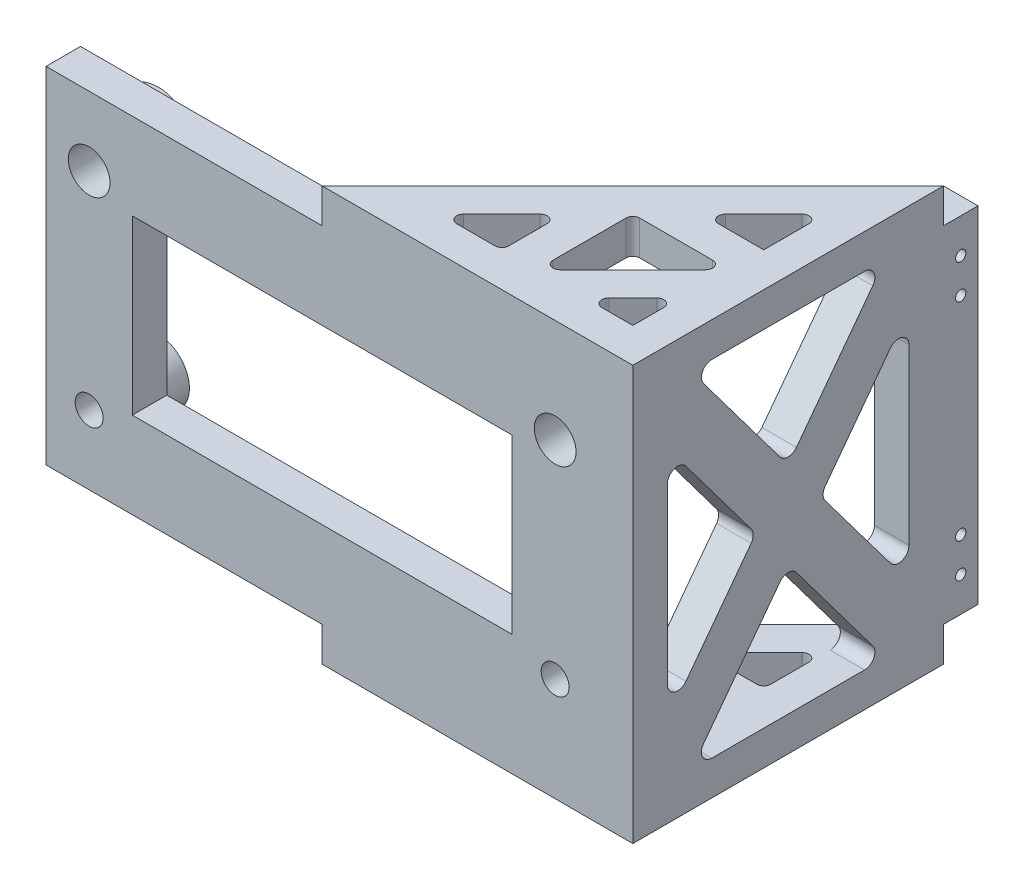
from build123d import *

# Parameters (mm, degrees)
SKETCH1_W            = 160
SKETCH1_H            = 100
SKETCH1_R            = 6.05
SKETCH1_R_2          = 4.05
SKETCH1_W_2          = 110
SKETCH1_H_2          = 50
BOSS_EXTRUDE1_DEPTH  = 10
SKETCH4_W            = 10
SKETCH4_H            = 100
BOSS_EXTRUDE3_DEPTH  = 100
BOSS_EXTRUDE4_DEPTH  = 5
BOSS_EXTRUDE5_DEPTH  = 10
CUT_EXTRUDE1_DEPTH   = 10
FILLET1_R            = 3
FILLET2_R            = 2
SKETCH13_R           = 1.5
CUT_EXTRUDE2_DEPTH   = 10
BOSS_EXTRUDE10_START = 10
SKETCH14_R           = 11.05
SKETCH14_R_2         = 6.05
SKETCH14_R_3         = 9.05
SKETCH14_R_4         = 4.05
BOSS_EXTRUDE10_DEPTH = 10


with BuildPart() as part:
    # Sketch1 → Boss-Extrude1 (new body)
    with BuildSketch(Plane.XY):
        with Locations((0, -30)):
            Rectangle(SKETCH1_W, SKETCH1_H)
        with Locations((-67.5, 0)):
            Circle(SKETCH1_R, mode=Mode.SUBTRACT)
        with Locations((67.5, 0)):
            Circle(SKETCH1_R, mode=Mode.SUBTRACT)
        with Locations((67.5, -60)):
            Circle(SKETCH1_R_2, mode=Mode.SUBTRACT)
        with Locations((-67.5, -60)):
            Circle(SKETCH1_R_2, mode=Mode.SUBTRACT)
        with Locations((0, -30)):
            Rectangle(SKETCH1_W_2, SKETCH1_H_2, mode=Mode.SUBTRACT)
    extrude(amount=BOSS_EXTRUDE1_DEPTH)

    # Sketch4 → Boss-Extrude3 (add)
    with BuildSketch(Plane.XY.offset(10)):
        with Locations((85, -30)):
            Rectangle(SKETCH4_W, SKETCH4_H)
    extrude(amount=-BOSS_EXTRUDE3_DEPTH)

    # Sketch6 → Boss-Extrude4 (add, symmetric)
    with BuildSketch(Plane(origin=(0, 25, 0), x_dir=(1, 0, 0), z_dir=(0, 1, 0))):
        Polygon((90, -10), (90, 80), (0, -10), align=None)
        Polygon((42.071067812, 0), (24.142135624, 0), (42.071067812, 17.928932188), align=None, mode=Mode.SUBTRACT)
        Polygon((80, 0), (66.213203436, 0), (80, 13.786796564), align=None, mode=Mode.SUBTRACT)
        Polygon((52.071067812, 27.928932188), (80, 27.928932188), (52.071067812, 0), align=None, mode=Mode.SUBTRACT)
        Polygon((62.071067812, 37.928932188), (80, 55.857864376), (80, 37.928932188), align=None, mode=Mode.SUBTRACT)
    extrude(amount=BOSS_EXTRUDE4_DEPTH, both=True)

    # Sketch9 → Boss-Extrude5 (add)
    with BuildSketch(Plane(origin=(0, -90, 0), x_dir=(1, 0, 0), z_dir=(0, 1, 0))):
        Polygon((90, -10), (90, 80), (0, -10), align=None)
        Polygon((24.142135624, 0), (42.071067812, 17.928932188), (42.071067812, 0), align=None, mode=Mode.SUBTRACT)
        Polygon((80, 0), (66.213203436, 0), (80, 13.786796564), align=None, mode=Mode.SUBTRACT)
        Polygon((80, 27.928932188), (52.071067812, 0), (52.071067812, 27.928932188), align=None, mode=Mode.SUBTRACT)
        Polygon((80, 37.928932188), (62.071067812, 37.928932188), (80, 55.857864376), align=None, mode=Mode.SUBTRACT)
    extrude(amount=BOSS_EXTRUDE5_DEPTH)

    # Sketch12 → Cut-Extrude1 (cut)
    with BuildSketch(Plane(origin=(90, 0, 0), x_dir=(0, 0, -1), z_dir=(1, 0, 0))):
        Polygon((25.625, -30), (0, -64.166666667), (0, 4.166666667), align=None)
        Polygon((35, -17.5), (6.875, 20), (63.125, 20), align=None)
        Polygon((35, -42.5), (6.875, -80), (63.125, -80), align=None)
        Polygon((70, -64.166666667), (70, 4.166666667), (44.375, -30), align=None)
    extrude(amount=-CUT_EXTRUDE1_DEPTH, mode=Mode.SUBTRACT)

    # Fillet1
    fillet1_edges = [part.edges().sort_by_distance(p)[0] for p in [
        (85, -42.5, -35),
        (85, -80, -63.125),
        (85, -80, -6.875),
        (85, 20, -63.125),
        (85, -17.5, -35),
        (85, 20, -6.875),
        (85, -64.166666667, -70),
        (85, -30, -44.375),
        (85, 4.166666667, -70),
        (85, 4.166666667, 0),
        (85, -30, -25.625),
        (85, -64.166666667, 0),
    ]]
    fillet(fillet1_edges, radius=FILLET1_R)

    # Fillet2
    # the kernel refuses this fillet: 2 mm, written as the material it adds along each edge
    with BuildSketch(Plane(origin=(62.071067812, -90, -37.928932188), x_dir=(0.7071067811865511, 0, -0.7071067811865438), z_dir=(0, 1, 0)), Plane(origin=(80, -90, -55.857864376), x_dir=(0, 0, 1), z_dir=(0, 1, 0)), Plane(origin=(52.071067812, -90, 0), x_dir=(0, 0, -1), z_dir=(0, 1, 0)), Plane(origin=(42.071067812, -90, -17.928932188), x_dir=(0, 0, 1), z_dir=(0, 1, 0)), Plane(origin=(80, 20, -27.928932188), x_dir=(-0.7071067811865523, 0, 0.7071067811865427), z_dir=(0, 1, 0)), Plane(origin=(52.071067812, 30, 0), x_dir=(0.7071067811865515, 0, -0.7071067811865436), z_dir=(0, -1, 0))) as fillet2_piece_1:
        with BuildLine():
            CenterArc((FILLET2_R * 2.41421356237, -FILLET2_R), FILLET2_R, 90, 135)
            Line((FILLET2_R * 1.70710678119, -FILLET2_R * 1.70710678119), (0, 0))
            Line((0, 0), (FILLET2_R * 2.41421356237, 0))
        make_face()
    extrude(amount=10)
    with BuildSketch(Plane(origin=(80, -90, -27.928932188), x_dir=(-1, 0, 0), z_dir=(0, 1, 0)), Plane(origin=(24.142135624, -90, 0), x_dir=(1, 0, 0), z_dir=(0, 1, 0)), Plane(origin=(66.213203436, -90, 0), x_dir=(1, 0, 0), z_dir=(0, 1, 0)), Plane(origin=(80, -90, -13.786796564), x_dir=(-0.7071067811865519, 0, 0.7071067811865431), z_dir=(0, 1, 0)), Plane(origin=(62.071067812, 30, -37.928932188), x_dir=(0.7071067811865511, 0, -0.7071067811865438), z_dir=(0, -1, 0)), Plane(origin=(24.142135624, 20, 0), x_dir=(1, 0, 0), z_dir=(0, 1, 0)), Plane(origin=(66.213203436, 20, 0), x_dir=(1, 0, 0), z_dir=(0, 1, 0)), Plane(origin=(80, 20, -55.857864376), x_dir=(-0.7071067811865505, 0, 0.7071067811865446), z_dir=(0, 1, 0)), Plane(origin=(42.071067812, 20, -17.928932188), x_dir=(-0.7071067811865515, 0, 0.7071067811865437), z_dir=(0, 1, 0)), Plane(origin=(80, 20, -13.786796564), x_dir=(-0.7071067811865519, 0, 0.7071067811865431), z_dir=(0, 1, 0))) as fillet2_piece_2:
        with BuildLine():
            CenterArc((FILLET2_R * 2.41421356237, FILLET2_R), FILLET2_R, 135, 135)
            Line((FILLET2_R * 1.70710678119, FILLET2_R * 1.70710678119), (0, 0))
            Line((0, 0), (FILLET2_R * 2.41421356237, 0))
        make_face()
    extrude(amount=10)
    with BuildSketch(Plane(origin=(42.071067812, -90, 0), x_dir=(-1, 0, 0), z_dir=(0, 1, 0)), Plane(origin=(52.071067812, -90, -27.928932188), x_dir=(1, 0, 0), z_dir=(0, 1, 0)), Plane(origin=(52.071067812, 20, -27.928932188), x_dir=(1, 0, 0), z_dir=(0, 1, 0))) as fillet2_piece_3:
        with BuildLine():
            CenterArc((FILLET2_R, -FILLET2_R), FILLET2_R, 90, 90)
            Line((0, -FILLET2_R), (0, 0))
            Line((0, 0), (FILLET2_R, 0))
        make_face()
    extrude(amount=10)
    with BuildSketch(Plane(origin=(80, -90, -37.928932188), x_dir=(0, 0, -1), z_dir=(0, 1, 0)), Plane(origin=(42.071067812, 30, 0), x_dir=(-1, 0, 0), z_dir=(0, -1, 0))) as fillet2_piece_4:
        with BuildLine():
            CenterArc((FILLET2_R, FILLET2_R), FILLET2_R, 180, 90)
            Line((0, FILLET2_R), (0, 0))
            Line((0, 0), (FILLET2_R, 0))
        make_face()
    extrude(amount=10)

    # Sketch13 → Cut-Extrude2 (cut)
    with BuildSketch(Plane(origin=(90, 0, 0), x_dir=(0, 0, -1), z_dir=(1, 0, 0))):
        with Locations(Location((85, 10, 0), (0, 0, 90))):
            Circle(SKETCH13_R)
        with Locations(Location((85, 0, 0), (0, 0, 90))):
            Circle(SKETCH13_R)
        with Locations(Location((85, -60, 0), (0, 0, 90))):
            Circle(SKETCH13_R)
        with Locations(Location((85, -70, 0), (0, 0, 90))):
            Circle(SKETCH13_R)
    extrude(amount=-CUT_EXTRUDE2_DEPTH, mode=Mode.SUBTRACT)

    # Sketch14 → Boss-Extrude10 (add)
    # profile 1 of 4: a face of its own
    with BuildSketch(Plane(origin=(0, 0, 0), x_dir=(-1, 0, 0), z_dir=(0, 0, -1)).offset(BOSS_EXTRUDE10_START)):
        with Locations((-67.5, 0)):
            Circle(SKETCH14_R)
        with Locations((-67.5, 0)):
            Circle(SKETCH14_R_2, mode=Mode.SUBTRACT)
    # profile 2 of 4: a face of its own
    with BuildSketch(Plane(origin=(0, 0, 0), x_dir=(-1, 0, 0), z_dir=(0, 0, -1)).offset(BOSS_EXTRUDE10_START)):
        with Locations((67.5, 0)):
            Circle(SKETCH14_R)
        with Locations((67.5, 0)):
            Circle(SKETCH14_R_2, mode=Mode.SUBTRACT)
    # profile 3 of 4: a face of its own
    with BuildSketch(Plane(origin=(0, 0, 0), x_dir=(-1, 0, 0), z_dir=(0, 0, -1)).offset(BOSS_EXTRUDE10_START)):
        with Locations((67.5, -60)):
            Circle(SKETCH14_R_3)
        with Locations((67.5, -60)):
            Circle(SKETCH14_R_4, mode=Mode.SUBTRACT)
    # profile 4 of 4: a face of its own
    with BuildSketch(Plane(origin=(0, 0, 0), x_dir=(-1, 0, 0), z_dir=(0, 0, -1)).offset(BOSS_EXTRUDE10_START)):
        with Locations((-67.5, -60)):
            Circle(SKETCH14_R_3)
        with Locations((-67.5, -60)):
            Circle(SKETCH14_R_4, mode=Mode.SUBTRACT)
    extrude(amount=-BOSS_EXTRUDE10_DEPTH)


solid = part.part
